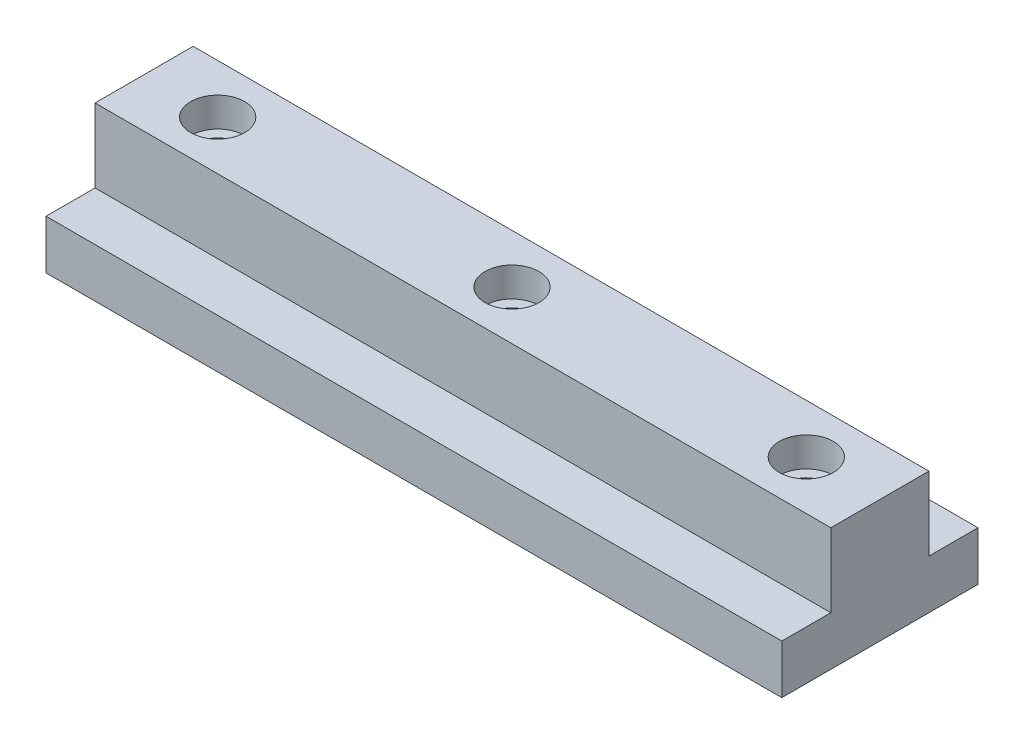
from build123d import *

# Parameters (mm, degrees)
EXTRUDE_START       = -75
EXTRUDE_1_DEPTH     = 150
SKETCH_2_R          = 5.5
CUT_EXTRUDE_1_DEPTH = 6
SKETCH_3_R          = 3.3
CUT_EXTRUDE_2_DEPTH = 82.547532152


# Read off the part's stored shape, not the designer's step: 凸台-拉伸1
with BuildPart() as part:
    # 凸台-拉伸1 outline → 凸台-拉伸1 (new body)
    with BuildSketch(Plane(origin=(0, 0, 0), x_dir=(0, 0, -1), z_dir=(1, 0, 0)).offset(EXTRUDE_START)):
        Polygon((20, 0), (20, 10), (10, 10), (10, 25), (-10, 25), (-10, 10), (-20, 10), (-20, 0), align=None)
    extrude(amount=EXTRUDE_1_DEPTH)

    # 草图2 → 切除-拉伸1 (cut)
    with BuildSketch(Plane(origin=(0, 25, 0), x_dir=(1, 0, 0), z_dir=(0, 1, 0))):
        with Locations(Location((-60, 0, 0), (0, 0, 270))):
            Circle(SKETCH_2_R)
        with Locations(Location((0, 0, 0), (0, 0, 270))):
            Circle(SKETCH_2_R)
        with Locations(Location((60, 0, 0), (0, 0, 270))):
            Circle(SKETCH_2_R)
    extrude(amount=-CUT_EXTRUDE_1_DEPTH, mode=Mode.SUBTRACT)

    # 草图3 → 切除-拉伸2 (cut, through all)
    with BuildSketch(Plane(origin=(0, 25, 0), x_dir=(1, 0, 0), z_dir=(0, 1, 0))):
        with Locations(Location((-60, 0, 0), (0, 0, 270))):
            Circle(SKETCH_3_R)
        with Locations(Location((0, 0, 0), (0, 0, 270))):
            Circle(SKETCH_3_R)
        with Locations(Location((60, 0, 0), (0, 0, 270))):
            Circle(SKETCH_3_R)
    extrude(amount=-CUT_EXTRUDE_2_DEPTH, mode=Mode.SUBTRACT)


solid = part.part
